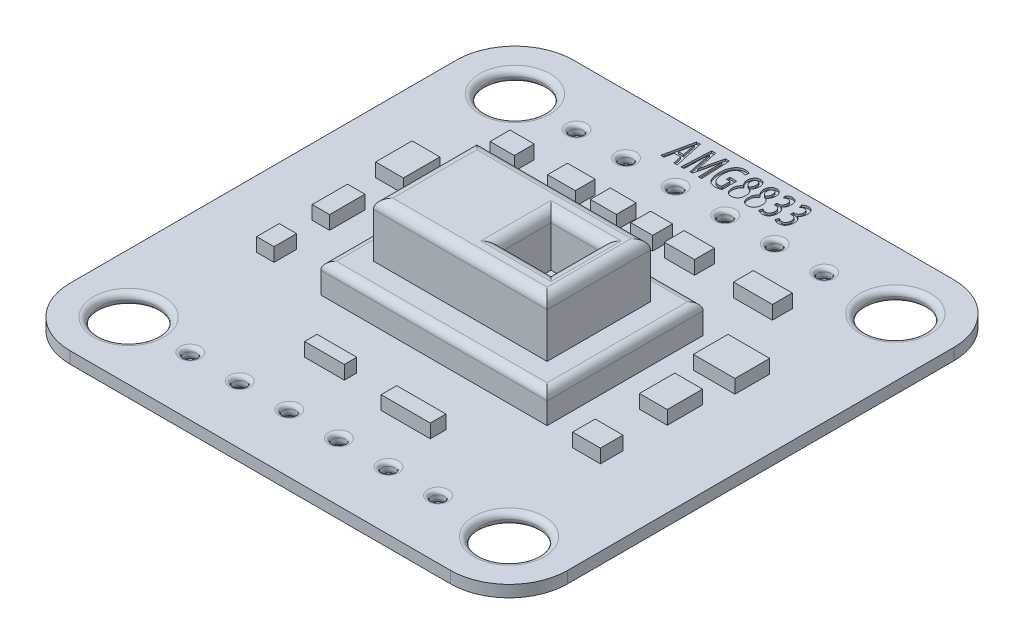
from build123d import *

# Parameters (mm, degrees)
CROQUIS1_W              = 25.5
CROQUIS1_H              = 25.8
SALIENTE_EXTRUIR1_DEPTH = 0.6
REDONDEO1_R             = 3
CROQUIS2_R              = 1.5
CORTAR_EXTRUIR1_DEPTH   = 19.147520492
REDONDEO3_R             = 0.3
CROQUIS3_W              = 11.6
CROQUIS3_H              = 8
SALIENTE_EXTRUIR2_DEPTH = 1.5
CROQUIS4_W              = 8.9
CROQUIS4_H              = 5.3
SALIENTE_EXTRUIR3_DEPTH = 2.8
REDONDEO4_R             = 0.4
REDONDEO5_R             = 0.5
CROQUIS5_W              = 2.6
CROQUIS5_H              = 2.6
CORTAR_EXTRUIR2_DEPTH   = 2.6
REDONDEO6_R             = 0.5
CROQUIS6_W              = 1.241092342
CROQUIS6_H              = 1.019085601
CROQUIS6_W_2            = 1.417923928
CROQUIS6_W_3            = 1.329303683
CROQUIS6_W_4            = 1.12466552
CROQUIS6_W_5            = 1.550854297
CROQUIS6_W_6            = 1.993955524
CROQUIS6_W_7            = 2.13557037
CROQUIS6_H_2            = 1.779641975
CROQUIS6_W_8            = 1.42371358
CROQUIS6_H_3            = 1.809919236
CROQUIS6_H_4            = 1.156767284
CROQUIS6_W_9            = 2.037698147
CROQUIS6_H_5            = 0.635905205
CROQUIS6_W_10           = 2.519879521
CROQUIS6_H_6            = 0.799384874
CROQUIS6_H_7            = 1.868624073
CROQUIS6_W_11           = 0.889820988
CROQUIS6_H_8            = 1.156767283
SALIENTE_EXTRUIR4_DEPTH = 0.7
CROQUIS7_R              = 0.325
CORTAR_EXTRUIR3_DEPTH   = 19.640346027
REDONDEO7_R             = 0.2
REDONDEO8_R             = 0.2
CORTAR_EXTRUIR4_DEPTH   = 0.1


with BuildPart() as part:
    # Croquis1 → Saliente-Extruir1 (new body)
    with BuildSketch(Plane(origin=(0, 0, 0), x_dir=(1, 0, 0), z_dir=(0, 1, 0))):
        Rectangle(CROQUIS1_W, CROQUIS1_H)
    extrude(amount=SALIENTE_EXTRUIR1_DEPTH)

    # Redondeo1
    redondeo1_edges = [part.edges().sort_by_distance(p)[0] for p in [
        (12.75, 0.3, 12.9),
        (-12.75, 0.3, 12.9),
        (-12.75, 0.3, -12.9),
        (12.75, 0.3, -12.9),
    ]]
    fillet(redondeo1_edges, radius=REDONDEO1_R)

    # Croquis2 → Cortar-Extruir1 (cut, through all)
    with BuildSketch(Plane.XZ):
        with Locations(Location((9.75, -9.9, 0), (0, 0, 270))):
            Circle(CROQUIS2_R)
        with Locations(Location((-9.75, -9.9, 0), (0, 0, 270))):
            Circle(CROQUIS2_R)
        with Locations(Location((-9.75, 9.9, 0), (0, 0, 270))):
            Circle(CROQUIS2_R)
        with Locations(Location((9.75, 9.9, 0), (0, 0, 270))):
            Circle(CROQUIS2_R)
    extrude(amount=-CORTAR_EXTRUIR1_DEPTH, mode=Mode.SUBTRACT)

    # Redondeo3
    redondeo3_edges = [part.edges().sort_by_distance(p)[0] for p in [
        (9.75, 0.6, 11.4),
        (9.75, 0, 11.4),
        (-9.75, 0.6, 11.4),
        (-9.75, 0, 11.4),
        (-9.75, 0.6, -8.4),
        (-9.75, 0, -8.4),
        (9.75, 0.6, -8.4),
        (9.75, 0, -8.4),
    ]]
    fillet(redondeo3_edges, radius=REDONDEO3_R - 0.0001)  # a hair under: the kernel refuses the full size

    # Croquis3 → Saliente-Extruir2 (add)
    with BuildSketch(Plane(origin=(0, 0.6, 0), x_dir=(1, 0, 0), z_dir=(0, 1, 0))):
        Rectangle(CROQUIS3_W, CROQUIS3_H)
    extrude(amount=SALIENTE_EXTRUIR2_DEPTH)

    # Croquis4 → Saliente-Extruir3 (add)
    with BuildSketch(Plane(origin=(0, 2.1, 0), x_dir=(1, 0, 0), z_dir=(0, 1, 0))):
        Rectangle(CROQUIS4_W, CROQUIS4_H)
    extrude(amount=SALIENTE_EXTRUIR3_DEPTH)

    # Redondeo4
    redondeo4_edges = [part.edges().sort_by_distance(p)[0] for p in [
        (5.8, 2.1, 0),
        (0, 2.1, -4),
        (-5.8, 2.1, 0),
        (0, 2.1, 4),
    ]]
    fillet(redondeo4_edges, radius=REDONDEO4_R)

    # Redondeo5
    redondeo5_edges = [part.edges().sort_by_distance(p)[0] for p in [
        (4.45, 4.9, 0),
        (0, 4.9, -2.65),
        (-4.45, 4.9, 0),
        (0, 4.9, 2.65),
    ]]
    fillet(redondeo5_edges, radius=REDONDEO5_R)

    # Croquis5 → Cortar-Extruir2 (cut)
    with BuildSketch(Plane(origin=(0, 4.9, 0), x_dir=(1, 0, 0), z_dir=(0, 1, 0))):
        with Locations((2, 0)):
            Rectangle(CROQUIS5_W, CROQUIS5_H)
    extrude(amount=-CORTAR_EXTRUIR2_DEPTH, mode=Mode.SUBTRACT)

    # Redondeo6
    redondeo6_edges = [part.edges().sort_by_distance(p)[0] for p in [
        (3.3, 4.9, 0),
        (2, 4.9, -1.3),
        (0.7, 4.9, 0),
        (2, 4.9, 1.3),
    ]]
    fillet(redondeo6_edges, radius=REDONDEO6_R)

    # Croquis6 → Saliente-Extruir4 (add)
    with BuildSketch(Plane(origin=(0, 0.6, 0), x_dir=(1, 0, 0), z_dir=(0, 1, 0))):
        with Locations((-6.953062528, 6.960785668)):
            Rectangle(CROQUIS6_W, CROQUIS6_H)
        with Locations((-3.917614666, 6.960785668)):
            Rectangle(CROQUIS6_W_2, CROQUIS6_H)
        with Locations((-1.768573713, 6.960785668)):
            Rectangle(CROQUIS6_W_3, CROQUIS6_H)
        with Locations((0.194770525, 6.960785668)):
            Rectangle(CROQUIS6_W_4, CROQUIS6_H)
        with Locations((2.130717091, 6.960785668)):
            Rectangle(CROQUIS6_W_5, CROQUIS6_H)
        with Locations((5.897077525, 6.960785668)):
            Rectangle(CROQUIS6_W_6, CROQUIS6_H)
        with Locations((8.151199134, 3.099234825)):
            Rectangle(CROQUIS6_W_7, CROQUIS6_H_2)
        with Locations((8.151199134, 0)):
            Rectangle(CROQUIS6_W_8, CROQUIS6_H_3)
        with Locations((8.151199134, -3.752386777)):
            Rectangle(CROQUIS6_W_8, CROQUIS6_H_4)
        with Locations((-2.433225553, -6.860971984)):
            Rectangle(CROQUIS6_W_9, CROQUIS6_H_5)
        with Locations((2.130717091, -7.178924586)):
            Rectangle(CROQUIS6_W_10, CROQUIS6_H_6)
        with Locations((-8.888872774, 3.54414532)):
            Rectangle(CROQUIS6_W_8, CROQUIS6_H_7)
        with Locations((-8.888872774, 0)):
            Rectangle(CROQUIS6_W_11, CROQUIS6_H_3)
        with Locations((-8.888872774, -3.174003136)):
            Rectangle(CROQUIS6_W_11, CROQUIS6_H_8)
    extrude(amount=SALIENTE_EXTRUIR4_DEPTH)

    # Croquis7 → Cortar-Extruir3 (cut, through all)
    with BuildSketch(Plane(origin=(0, 0.6, 0), x_dir=(1, 0, 0), z_dir=(0, 1, 0))):
        with Locations(Location((-6.594083047, 9.9, 0), (0, 0, 270))):
            Circle(CROQUIS7_R)
        with Locations(Location((-4.054083047, 9.9, 0), (0, 0, 270))):
            Circle(CROQUIS7_R)
        with Locations(Location((-1.514083047, 9.9, 0), (0, 0, 270))):
            Circle(CROQUIS7_R)
        with Locations(Location((1.025916953, 9.9, 0), (0, 0, 270))):
            Circle(CROQUIS7_R)
        with Locations(Location((3.565916953, 9.9, 0), (0, 0, 270))):
            Circle(CROQUIS7_R)
        with Locations(Location((6.105916953, 9.9, 0), (0, 0, 270))):
            Circle(CROQUIS7_R)
        with Locations(Location((6.105916953, -9.9, 0), (0, 0, 90))):
            Circle(CROQUIS7_R)
        with Locations(Location((3.565916953, -9.9, 0), (0, 0, 90))):
            Circle(CROQUIS7_R)
        with Locations(Location((1.025916953, -9.9, 0), (0, 0, 90))):
            Circle(CROQUIS7_R)
        with Locations(Location((-1.514083047, -9.9, 0), (0, 0, 90))):
            Circle(CROQUIS7_R)
        with Locations(Location((-4.054083047, -9.9, 0), (0, 0, 90))):
            Circle(CROQUIS7_R)
        with Locations(Location((-6.594083047, -9.9, 0), (0, 0, 90))):
            Circle(CROQUIS7_R)
    extrude(amount=-CORTAR_EXTRUIR3_DEPTH, mode=Mode.SUBTRACT)

    # Redondeo7
    redondeo7_edges = [part.edges().sort_by_distance(p)[0] for p in [
        (1.025916953, 0, -10.225),
        (3.565916953, 0, -10.225),
        (3.565916953, 0.6, -10.225),
        (-6.594083047, 0, -10.225),
        (-6.594083047, 0.6, -10.225),
        (-4.054083047, 0, -10.225),
        (-4.054083047, 0.6, -10.225),
        (-1.514083047, 0, -10.225),
        (-1.514083047, 0.6, -10.225),
    ]]
    fillet(redondeo7_edges, radius=REDONDEO7_R)

    # Redondeo8
    redondeo8_edges = [part.edges().sort_by_distance(p)[0] for p in [
        (1.025916953, 0.6, -10.225),
        (6.105916953, 0, -10.225),
        (6.105916953, 0.6, -10.225),
        (1.025916953, 0, 10.225),
        (1.025916953, 0.6, 10.225),
        (3.565916953, 0, 10.225),
        (3.565916953, 0.6, 10.225),
        (-1.514083047, 0, 10.225),
        (-1.514083047, 0.6, 10.225),
        (-4.054083047, 0, 10.225),
        (-4.054083047, 0.6, 10.225),
        (-6.594083047, 0, 10.225),
        (-6.594083047, 0.6, 10.225),
        (6.105916953, 0, 10.225),
        (6.105916953, 0.6, 10.225),
    ]]
    fillet(redondeo8_edges, radius=REDONDEO8_R)

    # Croquis8 → Cortar-Extruir4 (cut)
    # profile 1 of 7: a face of its own
    with BuildSketch(Plane(origin=(0, 0.6, 0), x_dir=(1, 0, 0), z_dir=(0, 1, 0))):
        Polygon((-2.764400595, 12.416489661), (-2.962346086, 12.416489661), (-3.2885493, 10.908742762), (-3.122654054, 10.908742762), (-3.03065122, 11.349566146), (-2.704459355, 11.349566146), (-2.608274575, 10.908742762), (-2.43820873, 10.908742762), align=None)
        with BuildLine():
            Line((-3.005559538, 11.527854714), (-2.920526616, 11.924550087))
            add(Edge.make_bspline(
                [(-2.920526616, 11.924550087), (-2.916048313, 11.948626049), (-2.906891621, 11.997853653), (-2.894461995, 12.072451535), (-2.882642299, 12.147072958), (-2.874462424, 12.196368554), (-2.870465323, 12.220456883)],
                knots=[0, 0, 0, 0, 0.979142055, 2.002030703, 3.023690823, 4, 4, 4, 4], degree=3))
            Line((-2.870465323, 12.220456883), (-2.867555288, 12.220568158))
            add(Edge.make_bspline(
                [(-2.867555288, 12.220568158), (-2.863662854, 12.196618467), (-2.855693728, 12.14758537), (-2.84263149, 12.073324881), (-2.829367717, 11.997845382), (-2.819525579, 11.94757712), (-2.81462631, 11.922554333)],
                knots=[0, 0, 0, 0, 0.961914449, 1.969363357, 2.989179584, 4, 4, 4, 4], degree=3))
            Line((-2.81462631, 11.922554333), (-2.730945019, 11.527854714))
            Line((-2.730945019, 11.527854714), (-3.005559538, 11.527854714))
        make_face(mode=Mode.SUBTRACT)
    # profile 2 of 7: a face of its own
    with BuildSketch(Plane(origin=(0, 0.6, 0), x_dir=(1, 0, 0), z_dir=(0, 1, 0))):
        with BuildLine():
            Line((-1.268873463, 12.415728175), (-1.471321993, 12.415728175))
            Line((-1.471321993, 12.415728175), (-1.626299833, 11.756505461))
            add(Edge.make_bspline(
                [(-1.626299833, 11.756505461), (-1.636389672, 11.710881327), (-1.656162529, 11.621472626), (-1.683054942, 11.489435003), (-1.707300051, 11.362274166), (-1.721503439, 11.278870207), (-1.728458309, 11.238030398)],
                knots=[0, 0, 0, 0, 1.060921548, 2.079066685, 3.059390553, 4, 4, 4, 4], degree=3))
            Line((-1.728458309, 11.238030398), (-1.732410786, 11.238030398))
            add(Edge.make_bspline(
                [(-1.732410786, 11.238030398), (-1.739306373, 11.27924215), (-1.753318672, 11.362987222), (-1.776586546, 11.490282051), (-1.802487074, 11.621185731), (-1.820882201, 11.709606578), (-1.830215698, 11.754470402)],
                knots=[0, 0, 0, 0, 0.953857503, 1.938303067, 2.953916282, 4, 4, 4, 4], degree=3))
            Line((-1.830215698, 11.754470402), (-1.980933809, 12.415728175))
            Line((-1.980933809, 12.415728175), (-2.181986142, 12.415728175))
            Line((-2.181986142, 12.415728175), (-2.254535504, 10.918193387))
            Line((-2.254535504, 10.918193387), (-2.103799124, 10.918193387))
            Line((-2.103799124, 10.918193387), (-2.080063779, 11.532618502))
            add(Edge.make_bspline(
                [(-2.080063779, 11.532618502), (-2.07799724, 11.586443032), (-2.073827016, 11.695059557), (-2.069204966, 11.830807), (-2.065665491, 11.93898623), (-2.063794803, 12.017507278), (-2.062037377, 12.093186493), (-2.061112421, 12.142603124), (-2.060657917, 12.166885444)],
                knots=[0, 0, 0, 0, 1.527873866, 3.083210374, 3.852754726, 4.598036934, 5.311104062, 6, 6, 6, 6], degree=3))
            Line((-2.060657917, 12.166885444), (-2.056328434, 12.166907865))
            add(Edge.make_bspline(
                [(-2.056328434, 12.166907865), (-2.049160872, 12.120575255), (-2.034643174, 12.026729843), (-2.00931025, 11.884785972), (-1.980640242, 11.739967165), (-1.959611896, 11.642667624), (-1.948979892, 11.59347264)],
                knots=[0, 0, 0, 0, 0.964146216, 1.952851327, 2.964954549, 4, 4, 4, 4], degree=3))
            Line((-1.948979892, 11.59347264), (-1.802220624, 10.931907892))
            Line((-1.802220624, 10.931907892), (-1.680751506, 10.931907892))
            Line((-1.680751506, 10.931907892), (-1.521585076, 11.607247489))
            add(Edge.make_bspline(
                [(-1.521585076, 11.607247489), (-1.510503263, 11.6550693), (-1.488527041, 11.749904212), (-1.45778466, 11.891123119), (-1.428891866, 12.029763094), (-1.411609861, 12.121505586), (-1.403061424, 12.166885444)],
                knots=[0, 0, 0, 0, 1.02964351, 2.041874823, 3.031425434, 4, 4, 4, 4], degree=3))
            Line((-1.403061424, 12.166885444), (-1.398719761, 12.166907865))
            add(Edge.make_bspline(
                [(-1.398719761, 12.166907865), (-1.398797642, 12.142807295), (-1.398956434, 12.093668106), (-1.398287712, 12.018734702), (-1.397271715, 11.94125297), (-1.394427882, 11.835245237), (-1.390486184, 11.702587858), (-1.386762759, 11.596589072), (-1.384920831, 11.544152903)],
                knots=[0, 0, 0, 0, 0.696372589, 1.419849533, 2.16522606, 2.935329954, 4.483949109, 6, 6, 6, 6], degree=3))
            Line((-1.384920831, 11.544152903), (-1.361022449, 10.918193387))
            Line((-1.361022449, 10.918193387), (-1.204648412, 10.918193387))
            Line((-1.204648412, 10.918193387), (-1.268873463, 12.415728175))
        make_face()
    # profile 3 of 7: a face of its own
    with BuildSketch(Plane(origin=(0, 0.6, 0), x_dir=(1, 0, 0), z_dir=(0, 1, 0))):
        with BuildLine():
            Line((-0.190327799, 11.709260643), (-0.537451544, 11.709260643))
            Line((-0.537451544, 11.709260643), (-0.537451544, 11.530972075))
            Line((-0.537451544, 11.530972075), (-0.348220934, 11.530972075))
            Line((-0.348220934, 11.530972075), (-0.348220934, 11.105833761))
            add(Edge.make_bspline(
                [(-0.348220934, 11.105833761), (-0.351696156, 11.103397337), (-0.359020517, 11.098262342), (-0.372076466, 11.092444867), (-0.387133711, 11.087516611), (-0.404284847, 11.082748713), (-0.423802141, 11.079735444), (-0.445404844, 11.076652449), (-0.469280143, 11.075208984), (-0.485922023, 11.07454499), (-0.494614544, 11.074198168)],
                knots=[0, 0, 0, 0, 0.669732272, 1.411524396, 2.247639135, 3.175225154, 4.221402202, 5.366457803, 6.624427111, 8, 8, 8, 8], degree=3))
            add(Edge.make_bspline(
                [(-0.494614544, 11.074198168), (-0.507969933, 11.074707965), (-0.534210459, 11.075709608), (-0.572493351, 11.083032692), (-0.608756696, 11.094573752), (-0.642876832, 11.111067459), (-0.675089043, 11.131767875), (-0.705024223, 11.157464023), (-0.733184255, 11.187289479), (-0.759020179, 11.221810296), (-0.782213175, 11.260786636), (-0.80264251, 11.304051246), (-0.819883182, 11.351614773), (-0.833888502, 11.403424823), (-0.845267578, 11.459457912), (-0.853289276, 11.519782778), (-0.858394839, 11.584318433), (-0.859439211, 11.628704885), (-0.859977423, 11.651579227)],
                knots=[0, 0, 0, 0, 0.840022945, 1.650468165, 2.443920939, 3.22841292, 4.028255306, 4.846621894, 5.704631313, 6.604782332, 7.55407384, 8.554051379, 9.611115594, 10.733290272, 11.92845612, 13.206533379, 14.560400581, 16, 16, 16, 16], degree=3))
            add(Edge.make_bspline(
                [(-0.859977423, 11.651579227), (-0.859487722, 11.675117584), (-0.858536381, 11.720845523), (-0.852775809, 11.787082455), (-0.844067753, 11.848892312), (-0.832372262, 11.906266278), (-0.817090576, 11.959158283), (-0.79862558, 12.007614529), (-0.777338042, 12.051822827), (-0.75216505, 12.091038392), (-0.724657838, 12.125840972), (-0.694788121, 12.156060714), (-0.662871917, 12.181794412), (-0.628981125, 12.203026347), (-0.592893721, 12.219279798), (-0.554814692, 12.230936872), (-0.51464383, 12.238278327), (-0.487087802, 12.239053538), (-0.47307259, 12.239447816)],
                knots=[0, 0, 0, 0, 1.434220963, 2.786259491, 4.048201453, 5.235976806, 6.350984325, 7.398765591, 8.392586444, 9.334829251, 10.232120147, 11.091064484, 11.918224649, 12.724958455, 13.52110572, 14.322336264, 15.146727113, 16, 16, 16, 16], degree=3))
            add(Edge.make_bspline(
                [(-0.47307259, 12.239447816), (-0.461061194, 12.239270524), (-0.438025679, 12.238930511), (-0.404926965, 12.235239557), (-0.374497616, 12.230524568), (-0.346825713, 12.222922061), (-0.321558097, 12.214030364), (-0.298043254, 12.204478452), (-0.276567182, 12.193475961), (-0.26326696, 12.185119324), (-0.256802709, 12.181057783)],
                knots=[0, 0, 0, 0, 1.267740505, 2.431279107, 3.513846429, 4.515803912, 5.456104541, 6.341779672, 7.194062062, 8, 8, 8, 8], degree=3))
            Line((-0.256802709, 12.181057783), (-0.219932762, 12.370299465))
            add(Edge.make_bspline(
                [(-0.219932762, 12.370299465), (-0.227229977, 12.37491302), (-0.242354063, 12.384474999), (-0.267554558, 12.396593542), (-0.295734716, 12.407299554), (-0.326772528, 12.416635153), (-0.360435171, 12.423872948), (-0.396222208, 12.429190144), (-0.433981091, 12.43273101), (-0.459836803, 12.43312415), (-0.47307259, 12.433325403)],
                knots=[0, 0, 0, 0, 0.783008094, 1.622849696, 2.532134412, 3.516884653, 4.561348015, 5.653977854, 6.799048724, 8, 8, 8, 8], degree=3))
            add(Edge.make_bspline(
                [(-0.47307259, 12.433325403), (-0.493431738, 12.432478512), (-0.533272385, 12.43082124), (-0.591294781, 12.420308156), (-0.646191551, 12.40394505), (-0.697884492, 12.380859107), (-0.746123114, 12.351005052), (-0.791180438, 12.314989129), (-0.833083837, 12.272645303), (-0.87158756, 12.224096305), (-0.906076995, 12.169615149), (-0.936131749, 12.109632096), (-0.961999305, 12.04462258), (-0.98272835, 11.974144103), (-0.999594022, 11.898612244), (-1.011063069, 11.817661771), (-1.01898188, 11.731568656), (-1.020298151, 11.672384087), (-1.020975186, 11.641942037)],
                knots=[0, 0, 0, 0, 0.906699512, 1.774312703, 2.618366945, 3.452862323, 4.287941105, 5.138391531, 6.016232104, 6.935693918, 7.893004635, 8.882947244, 9.919948231, 11.005043757, 12.151655388, 13.363972965, 14.644138676, 16, 16, 16, 16], degree=3))
            add(Edge.make_bspline(
                [(-1.020975186, 11.641942037), (-1.021586059, 11.62484134), (-1.022831851, 11.589966858), (-1.020293999, 11.536659539), (-1.014585212, 11.481498991), (-1.005480197, 11.424536902), (-0.992827762, 11.365857729), (-0.977321929, 11.305250391), (-0.957807008, 11.243025455), (-0.939502551, 11.190342964), (-0.922591182, 11.148482338), (-0.907514428, 11.118777483), (-0.890727368, 11.090781083), (-0.872057525, 11.064624288), (-0.851201882, 11.040514874), (-0.828723416, 11.017992895), (-0.804442567, 10.997162458), (-0.777733976, 10.978908045), (-0.74973994, 10.961666373), (-0.719613347, 10.946743401), (-0.687662932, 10.933669617), (-0.653848677, 10.922361486), (-0.618183647, 10.912721608), (-0.580600132, 10.905080631), (-0.541121121, 10.899433166), (-0.514091794, 10.897101379), (-0.500283479, 10.895910153)],
                knots=[0, 0, 0, 0, 1.200937957, 2.449145116, 3.742844556, 5.092948573, 6.496738947, 7.955995764, 9.483464093, 11.073764752, 11.870794349, 12.651001375, 13.409793533, 14.160862787, 14.904099292, 15.64520142, 16.393482676, 17.146132082, 17.914031917, 18.700166393, 19.503328029, 20.336103367, 21.201806113, 22.095544012, 23.027081715, 24, 24, 24, 24], degree=3))
            add(Edge.make_bspline(
                [(-0.500283479, 10.895910153), (-0.484114448, 10.896471192), (-0.452372217, 10.897572596), (-0.405905824, 10.902504799), (-0.36152697, 10.909645785), (-0.319916743, 10.920018228), (-0.281597736, 10.931528845), (-0.247093586, 10.943332425), (-0.217071878, 10.955635989), (-0.19893097, 10.964778454), (-0.190476166, 10.969039418)],
                knots=[0, 0, 0, 0, 1.209195894, 2.37383259, 3.490953063, 4.566847826, 5.576966633, 6.481686065, 7.292370178, 8, 8, 8, 8], degree=3))
            Line((-0.190476166, 10.969039418), (-0.190327799, 11.709260643))
        make_face()
    # profile 4 of 7: a face of its own
    with BuildSketch(Plane(origin=(0, 0.6, 0), x_dir=(1, 0, 0), z_dir=(0, 1, 0))):
        with BuildLine():
            add(Edge.make_bspline(
                [(0.193356149, 11.68007227), (0.1785492, 11.670055793), (0.149049568, 11.650100136), (0.110576786, 11.612336066), (0.076664892, 11.569597675), (0.047598932, 11.521405578), (0.024134701, 11.467749991), (0.007760194, 11.408574082), (-0.003109068, 11.344339011), (-0.004422547, 11.299680216), (-0.005101982, 11.276579158)],
                knots=[0, 0, 0, 0, 0.911404418, 1.815775479, 2.739708829, 3.692232617, 4.681957349, 5.720608342, 6.820918456, 8, 8, 8, 8], degree=3))
            add(Edge.make_bspline(
                [(-0.005101982, 11.276579158), (-0.004810586, 11.263343088), (-0.004238943, 11.237377368), (-0.000325718, 11.199345118), (0.006611902, 11.163088591), (0.015811798, 11.12840306), (0.028107491, 11.095444407), (0.042869752, 11.064135249), (0.060217079, 11.034463073), (0.080242124, 11.006752324), (0.1028913, 10.981408686), (0.128219317, 10.959105912), (0.156316294, 10.940328162), (0.186791859, 10.924587387), (0.219896499, 10.912513613), (0.255395684, 10.90342009), (0.29336004, 10.897365167), (0.319610665, 10.896215363), (0.333050008, 10.895626706)],
                knots=[0, 0, 0, 0, 1.107648422, 2.172917551, 3.19484565, 4.1941329, 5.172301612, 6.134327233, 7.087637994, 8.044483428, 8.990685234, 9.926389602, 10.860589487, 11.811832291, 12.790001003, 13.80255694, 14.874991015, 16, 16, 16, 16], degree=3))
            add(Edge.make_bspline(
                [(0.333050008, 10.895626706), (0.345824235, 10.896033183), (0.370826603, 10.896828759), (0.40730887, 10.90231231), (0.441747722, 10.911145888), (0.474463397, 10.923019967), (0.505039507, 10.938654643), (0.533611011, 10.957640717), (0.560561338, 10.979503054), (0.585095522, 11.005161453), (0.607487902, 11.033631591), (0.626900177, 11.065144835), (0.643253314, 11.099427363), (0.657332141, 11.136200396), (0.667556397, 11.176014472), (0.675524141, 11.218321886), (0.680739014, 11.263509826), (0.681554119, 11.294610925), (0.681972975, 11.310592769)],
                knots=[0, 0, 0, 0, 1.004575452, 1.966206168, 2.894436783, 3.797272911, 4.697934967, 5.588329482, 6.491318517, 7.421540057, 8.374430723, 9.335458257, 10.325916415, 11.358334626, 12.427256579, 13.553903944, 14.743030673, 16, 16, 16, 16], degree=3))
            add(Edge.make_bspline(
                [(0.681972975, 11.310592769), (0.681154516, 11.332651205), (0.67956765, 11.375419155), (0.668983739, 11.436924959), (0.652046329, 11.493495129), (0.628334839, 11.544732874), (0.599309642, 11.590753134), (0.566042133, 11.631636954), (0.52832027, 11.667146612), (0.499997831, 11.686242864), (0.485827814, 11.695796922)],
                knots=[0, 0, 0, 0, 1.171501565, 2.271363273, 3.304917842, 4.299727248, 5.260519595, 6.187826369, 7.093350242, 8, 8, 8, 8], degree=3))
            Line((0.485827814, 11.695796922), (0.486064757, 11.701922029))
            add(Edge.make_bspline(
                [(0.486064757, 11.701922029), (0.498931474, 11.712902216), (0.524440343, 11.734670951), (0.557397786, 11.772330855), (0.584886977, 11.813522613), (0.606627858, 11.857879053), (0.622957399, 11.904168431), (0.635493424, 11.951209349), (0.642716757, 11.999047586), (0.643566043, 12.031185814), (0.643991108, 12.04727091)],
                knots=[0, 0, 0, 0, 1.031979959, 2.045948748, 3.044565518, 4.048386527, 5.054063212, 6.037934608, 7.017991582, 8, 8, 8, 8], degree=3))
            add(Edge.make_bspline(
                [(0.643991108, 12.04727091), (0.643777313, 12.05880571), (0.643355779, 12.08154864), (0.639906299, 12.114998475), (0.634163731, 12.147281064), (0.626445953, 12.178476139), (0.615611429, 12.208339957), (0.603435151, 12.237384622), (0.588132359, 12.264911104), (0.571128495, 12.291223676), (0.551582885, 12.31538097), (0.529672771, 12.336898503), (0.505056354, 12.355177792), (0.477952669, 12.370217919), (0.448535119, 12.382165717), (0.41677108, 12.390952375), (0.382553555, 12.396609405), (0.358864682, 12.3980186), (0.346655452, 12.398744898)],
                knots=[0, 0, 0, 0, 1.070993307, 2.11165556, 3.118517725, 4.114425173, 5.091211043, 6.065866687, 7.035692375, 8.011532052, 8.972105901, 9.915210373, 10.855781041, 11.810244717, 12.786202718, 13.797375475, 14.864768794, 16, 16, 16, 16], degree=3))
            add(Edge.make_bspline(
                [(0.346655452, 12.398744898), (0.335672497, 12.398441494), (0.314056918, 12.397844364), (0.282470489, 12.392430629), (0.252350057, 12.384601171), (0.223557602, 12.37375607), (0.196436349, 12.359532592), (0.170641868, 12.342280583), (0.146208996, 12.322176076), (0.123560638, 12.298840697), (0.10286139, 12.272793333), (0.084605708, 12.244055392), (0.069401026, 12.212677798), (0.056526101, 12.178936025), (0.04637937, 12.142694443), (0.039125944, 12.103799767), (0.034181526, 12.062510141), (0.0333206, 12.034058021), (0.032879884, 12.019493127)],
                knots=[0, 0, 0, 0, 0.954965825, 1.879470434, 2.780837939, 3.660343497, 4.550239683, 5.439528016, 6.356397421, 7.29824966, 8.263809139, 9.24685125, 10.254308888, 11.29259344, 12.385771216, 13.524141038, 14.732585787, 16, 16, 16, 16], degree=3))
            add(Edge.make_bspline(
                [(0.032879884, 12.019493127), (0.033229667, 12.003301327), (0.033925109, 11.971108645), (0.042150107, 11.923687915), (0.054055995, 11.877357218), (0.071776605, 11.832868782), (0.094250697, 11.790655752), (0.122093825, 11.751643886), (0.155028479, 11.716195033), (0.180465114, 11.696049759), (0.193310753, 11.685876285)],
                knots=[0, 0, 0, 0, 1.009979823, 2.00805091, 2.996924765, 3.992813739, 4.990588339, 5.976147839, 6.977943669, 8, 8, 8, 8], degree=3))
            Line((0.193310753, 11.685876285), (0.193356149, 11.68007227))
        make_face()
        with BuildLine():
            add(Edge.make_bspline(
                [(0.341189137, 12.256170621), (0.347367452, 12.255508325), (0.359404391, 12.254218003), (0.37689185, 12.250765884), (0.392923806, 12.244590703), (0.407772208, 12.236817077), (0.42097725, 12.226469903), (0.433280809, 12.214748588), (0.443764513, 12.20049589), (0.456291679, 12.179095444), (0.468598223, 12.149179396), (0.479082075, 12.11050638), (0.485397129, 12.068925887), (0.48605603, 12.04020708), (0.486394707, 12.025445509)],
                knots=[0, 0, 0, 0, 0.737040501, 1.435943419, 2.106138943, 2.76794432, 3.415653856, 4.089213461, 4.777251942, 5.505627577, 7.027057119, 8.595626037, 10.250139479, 12, 12, 12, 12], degree=3))
            add(Edge.make_bspline(
                [(0.486394707, 12.025445509), (0.485789169, 12.010864369), (0.484605604, 11.982364583), (0.47717219, 11.941115209), (0.465143278, 11.902698793), (0.449112635, 11.86737616), (0.42957729, 11.835888974), (0.408031707, 11.808075861), (0.383504011, 11.785138047), (0.365257937, 11.773127128), (0.356292642, 11.767225507)],
                knots=[0, 0, 0, 0, 1.15994323, 2.267184327, 3.322678351, 4.35528353, 5.344037239, 6.264342936, 7.147176663, 8, 8, 8, 8], degree=3))
            add(Edge.make_bspline(
                [(0.356292642, 11.767225507), (0.344324841, 11.773471734), (0.320703327, 11.78580026), (0.288318303, 11.808876113), (0.260229376, 11.83617519), (0.235310311, 11.86656757), (0.215505937, 11.901674436), (0.201373337, 11.941443444), (0.192514356, 11.985854506), (0.191175025, 12.017087509), (0.190476285, 12.033382018)],
                knots=[0, 0, 0, 0, 0.973172951, 1.92080545, 2.856002324, 3.791671, 4.746993565, 5.747424678, 6.824813306, 8, 8, 8, 8], degree=3))
            add(Edge.make_bspline(
                [(0.190476285, 12.033382018), (0.190897024, 12.047673299), (0.19171573, 12.075482394), (0.198483991, 12.115768016), (0.210376145, 12.15302162), (0.223493689, 12.181936559), (0.2368807, 12.202559719), (0.247773555, 12.216391571), (0.260547792, 12.227732737), (0.274142806, 12.23750728), (0.289113958, 12.245283802), (0.30535592, 12.250882347), (0.322779171, 12.254665541), (0.334825967, 12.255474195), (0.341189137, 12.256170621)],
                knots=[0, 0, 0, 0, 1.719237767, 3.345427867, 4.895260788, 6.416002682, 7.147651972, 7.850831243, 8.526924288, 9.195712161, 9.861885491, 10.548696538, 11.257825366, 12, 12, 12, 12], degree=3))
        make_face(mode=Mode.SUBTRACT)
    # profile 5 of 7: a face of its own
    with BuildSketch(Plane(origin=(0, 0.6, 0), x_dir=(1, 0, 0), z_dir=(0, 1, 0))):
        with BuildLine():
            add(Edge.make_bspline(
                [(1.027823423, 11.68007227), (1.013016474, 11.670055793), (0.983516842, 11.650100136), (0.945044061, 11.612336066), (0.911132166, 11.569597675), (0.882066206, 11.521405578), (0.858601975, 11.467749991), (0.842227468, 11.408574082), (0.831358206, 11.344339011), (0.830044727, 11.299680216), (0.829365292, 11.276579158)],
                knots=[0, 0, 0, 0, 0.911404418, 1.815775479, 2.739708829, 3.692232617, 4.681957349, 5.720608342, 6.820918456, 8, 8, 8, 8], degree=3))
            add(Edge.make_bspline(
                [(0.829365292, 11.276579158), (0.829656688, 11.263343088), (0.830228332, 11.237377368), (0.834141556, 11.199345118), (0.841079176, 11.163088591), (0.850279072, 11.12840306), (0.862574765, 11.095444407), (0.877337026, 11.064135249), (0.894684353, 11.034463073), (0.914709398, 11.006752324), (0.937358574, 10.981408686), (0.962686591, 10.959105912), (0.990783569, 10.940328162), (1.021259133, 10.924587387), (1.054363773, 10.912513613), (1.089862958, 10.90342009), (1.127827315, 10.897365167), (1.15407794, 10.896215363), (1.167517282, 10.895626706)],
                knots=[0, 0, 0, 0, 1.107648422, 2.172917551, 3.19484565, 4.1941329, 5.172301612, 6.134327233, 7.087637994, 8.044483428, 8.990685234, 9.926389602, 10.860589487, 11.811832291, 12.790001003, 13.80255694, 14.874991015, 16, 16, 16, 16], degree=3))
            add(Edge.make_bspline(
                [(1.167517282, 10.895626706), (1.180291509, 10.896033183), (1.205293877, 10.896828759), (1.241776145, 10.90231231), (1.276214996, 10.911145888), (1.308930671, 10.923019967), (1.339506781, 10.938654643), (1.368078285, 10.957640717), (1.395028612, 10.979503054), (1.419562796, 11.005161453), (1.441955177, 11.033631591), (1.461367451, 11.065144835), (1.477720589, 11.099427363), (1.491799416, 11.136200396), (1.502023672, 11.176014472), (1.509991415, 11.218321886), (1.515206288, 11.263509826), (1.516021393, 11.294610925), (1.516440249, 11.310592769)],
                knots=[0, 0, 0, 0, 1.004575452, 1.966206168, 2.894436783, 3.797272911, 4.697934967, 5.588329482, 6.491318517, 7.421540057, 8.374430723, 9.335458257, 10.325916415, 11.358334626, 12.427256579, 13.553903944, 14.743030673, 16, 16, 16, 16], degree=3))
            add(Edge.make_bspline(
                [(1.516440249, 11.310592769), (1.51562179, 11.332651205), (1.514034925, 11.375419155), (1.503451014, 11.436924959), (1.486513604, 11.493495129), (1.462802113, 11.544732874), (1.433776916, 11.590753134), (1.400509408, 11.631636954), (1.362787544, 11.667146612), (1.334465105, 11.686242864), (1.320295088, 11.695796922)],
                knots=[0, 0, 0, 0, 1.171501565, 2.271363273, 3.304917842, 4.299727248, 5.260519595, 6.187826369, 7.093350242, 8, 8, 8, 8], degree=3))
            Line((1.320295088, 11.695796922), (1.320532032, 11.701922029))
            add(Edge.make_bspline(
                [(1.320532032, 11.701922029), (1.333398748, 11.712902216), (1.358907617, 11.734670951), (1.39186506, 11.772330855), (1.419354251, 11.813522613), (1.441095132, 11.857879053), (1.457424673, 11.904168431), (1.469960698, 11.951209349), (1.477184031, 11.999047586), (1.478033317, 12.031185814), (1.478458382, 12.04727091)],
                knots=[0, 0, 0, 0, 1.031979959, 2.045948748, 3.044565518, 4.048386527, 5.054063212, 6.037934608, 7.017991582, 8, 8, 8, 8], degree=3))
            add(Edge.make_bspline(
                [(1.478458382, 12.04727091), (1.478244588, 12.05880571), (1.477823053, 12.08154864), (1.474373573, 12.114998475), (1.468631005, 12.147281064), (1.460913227, 12.178476139), (1.450078703, 12.208339957), (1.437902425, 12.237384622), (1.422599634, 12.264911104), (1.405595769, 12.291223676), (1.386050159, 12.31538097), (1.364140045, 12.336898503), (1.339523628, 12.355177792), (1.312419943, 12.370217919), (1.283002393, 12.382165717), (1.251238354, 12.390952375), (1.217020829, 12.396609405), (1.193331956, 12.3980186), (1.181122726, 12.398744898)],
                knots=[0, 0, 0, 0, 1.070993307, 2.11165556, 3.118517725, 4.114425173, 5.091211043, 6.065866687, 7.035692375, 8.011532052, 8.972105901, 9.915210373, 10.855781041, 11.810244717, 12.786202718, 13.797375475, 14.864768794, 16, 16, 16, 16], degree=3))
            add(Edge.make_bspline(
                [(1.181122726, 12.398744898), (1.170139771, 12.398441494), (1.148524192, 12.397844364), (1.116937763, 12.392430629), (1.086817331, 12.384601171), (1.058024876, 12.37375607), (1.030903623, 12.359532592), (1.005109142, 12.342280583), (0.98067627, 12.322176076), (0.958027912, 12.298840697), (0.937328665, 12.272793333), (0.919072982, 12.244055392), (0.9038683, 12.212677798), (0.890993375, 12.178936025), (0.880846644, 12.142694443), (0.873593219, 12.103799767), (0.8686488, 12.062510141), (0.867787874, 12.034058021), (0.867347158, 12.019493127)],
                knots=[0, 0, 0, 0, 0.954965825, 1.879470434, 2.780837939, 3.660343497, 4.550239683, 5.439528016, 6.356397421, 7.29824966, 8.263809139, 9.24685125, 10.254308888, 11.29259344, 12.385771216, 13.524141038, 14.732585787, 16, 16, 16, 16], degree=3))
            add(Edge.make_bspline(
                [(0.867347158, 12.019493127), (0.867696941, 12.003301327), (0.868392383, 11.971108645), (0.876617381, 11.923687915), (0.88852327, 11.877357218), (0.90624388, 11.832868782), (0.928717971, 11.790655752), (0.956561099, 11.751643886), (0.989495753, 11.716195033), (1.014932388, 11.696049759), (1.027778027, 11.685876285)],
                knots=[0, 0, 0, 0, 1.009979823, 2.00805091, 2.996924765, 3.992813739, 4.990588339, 5.976147839, 6.977943669, 8, 8, 8, 8], degree=3))
            Line((1.027778027, 11.685876285), (1.027823423, 11.68007227))
        make_face()
        with BuildLine():
            add(Edge.make_bspline(
                [(1.175656411, 12.256170621), (1.181834727, 12.255508325), (1.193871665, 12.254218003), (1.211359125, 12.250765884), (1.22739108, 12.244590703), (1.242239482, 12.236817077), (1.255444525, 12.226469903), (1.267748083, 12.214748588), (1.278231788, 12.20049589), (1.290758953, 12.179095444), (1.303065497, 12.149179396), (1.313549349, 12.11050638), (1.319864403, 12.068925887), (1.320523304, 12.04020708), (1.320861981, 12.025445509)],
                knots=[0, 0, 0, 0, 0.737040501, 1.435943419, 2.106138943, 2.76794432, 3.415653856, 4.089213461, 4.777251942, 5.505627577, 7.027057119, 8.595626037, 10.250139479, 12, 12, 12, 12], degree=3))
            add(Edge.make_bspline(
                [(1.320861981, 12.025445509), (1.320256443, 12.010864369), (1.319072878, 11.982364583), (1.311639464, 11.941115209), (1.299610552, 11.902698793), (1.283579909, 11.86737616), (1.264044564, 11.835888974), (1.242498981, 11.808075861), (1.217971285, 11.785138047), (1.199725212, 11.773127128), (1.190759916, 11.767225507)],
                knots=[0, 0, 0, 0, 1.15994323, 2.267184327, 3.322678351, 4.35528353, 5.344037239, 6.264342936, 7.147176663, 8, 8, 8, 8], degree=3))
            add(Edge.make_bspline(
                [(1.190759916, 11.767225507), (1.178792115, 11.773471734), (1.155170601, 11.78580026), (1.122785577, 11.808876113), (1.09469665, 11.83617519), (1.069777585, 11.86656757), (1.049973211, 11.901674436), (1.035840611, 11.941443444), (1.02698163, 11.985854506), (1.025642299, 12.017087509), (1.024943559, 12.033382018)],
                knots=[0, 0, 0, 0, 0.973172951, 1.92080545, 2.856002324, 3.791671, 4.746993565, 5.747424678, 6.824813306, 8, 8, 8, 8], degree=3))
            add(Edge.make_bspline(
                [(1.024943559, 12.033382018), (1.025364298, 12.047673299), (1.026183004, 12.075482394), (1.032951265, 12.115768016), (1.04484342, 12.15302162), (1.057960963, 12.181936559), (1.071347975, 12.202559719), (1.08224083, 12.216391571), (1.095015066, 12.227732737), (1.10861008, 12.23750728), (1.123581232, 12.245283802), (1.139823194, 12.250882347), (1.157246445, 12.254665541), (1.169293242, 12.255474195), (1.175656411, 12.256170621)],
                knots=[0, 0, 0, 0, 1.719237767, 3.345427867, 4.895260788, 6.416002682, 7.147651972, 7.850831243, 8.526924288, 9.195712161, 9.861885491, 10.548696538, 11.257825366, 12, 12, 12, 12], degree=3))
        make_face(mode=Mode.SUBTRACT)
    # profile 6 of 7: a face of its own
    with BuildSketch(Plane(origin=(0, 0.6, 0), x_dir=(1, 0, 0), z_dir=(0, 1, 0))):
        with BuildLine():
            add(Edge.make_bspline(
                [(2.080507337, 11.702144856), (2.094342031, 11.70984588), (2.122020022, 11.725252716), (2.157895578, 11.757248379), (2.188945381, 11.795240567), (2.214453874, 11.839299726), (2.234774473, 11.888127862), (2.249452164, 11.940759593), (2.258409904, 11.996891401), (2.259595818, 12.035426833), (2.260204558, 12.055207419)],
                knots=[0, 0, 0, 0, 0.909036352, 1.818637979, 2.746141036, 3.72360333, 4.737627422, 5.78268975, 6.861834573, 8, 8, 8, 8], degree=3))
            add(Edge.make_bspline(
                [(2.260204558, 12.055207419), (2.259994432, 12.067686465), (2.259582914, 12.092125737), (2.256129907, 12.1280287), (2.25035966, 12.162356419), (2.243033604, 12.1952843), (2.232501331, 12.226315161), (2.220496164, 12.256064587), (2.205599221, 12.283987007), (2.189057316, 12.310550226), (2.169864985, 12.334634383), (2.148173901, 12.355797948), (2.124173927, 12.373830768), (2.097729411, 12.388642607), (2.069064911, 12.400685616), (2.037842845, 12.408942844), (2.004462546, 12.414856195), (1.98131967, 12.416008146), (1.969388178, 12.416602044)],
                knots=[0, 0, 0, 0, 1.146652644, 2.245632905, 3.310503886, 4.344629527, 5.341335152, 6.318485146, 7.289443235, 8.245731963, 9.190879238, 10.111908648, 11.02360021, 11.941185281, 12.890947715, 13.872562416, 14.903182783, 16, 16, 16, 16], degree=3))
            add(Edge.make_bspline(
                [(1.969388178, 12.416602044), (1.955665292, 12.416021062), (1.928649196, 12.414877289), (1.888923239, 12.40852738), (1.850972294, 12.398319665), (1.815108148, 12.384676511), (1.78196393, 12.368717951), (1.752161896, 12.350975591), (1.725303994, 12.332669369), (1.710237572, 12.318173269), (1.70294822, 12.311159847)],
                knots=[0, 0, 0, 0, 1.123537042, 2.211895237, 3.284951157, 4.334934573, 5.348396676, 6.291426242, 7.173367392, 8, 8, 8, 8], degree=3))
            Line((1.70294822, 12.311159847), (1.743947244, 12.144830573))
            add(Edge.make_bspline(
                [(1.743947244, 12.144830573), (1.749463689, 12.150391154), (1.760845153, 12.161863676), (1.780301416, 12.177696011), (1.802125897, 12.192828266), (1.825688571, 12.207525435), (1.850692621, 12.22076408), (1.877408115, 12.229926025), (1.90473129, 12.236606188), (1.923430494, 12.237742988), (1.932823545, 12.238314029)],
                knots=[0, 0, 0, 0, 0.870513675, 1.796033264, 2.784139576, 3.822097296, 4.884025601, 5.920812832, 6.955575191, 8, 8, 8, 8], degree=3))
            add(Edge.make_bspline(
                [(1.932823545, 12.238314029), (1.939640538, 12.237993953), (1.952886581, 12.237372016), (1.972021139, 12.233939175), (1.989758097, 12.22846442), (2.006232451, 12.221403669), (2.021577939, 12.212625025), (2.035136302, 12.201408743), (2.047414822, 12.188495174), (2.062291614, 12.169063579), (2.077082858, 12.140848495), (2.090239681, 12.103457141), (2.097867234, 12.061842488), (2.098749005, 12.03284641), (2.099206796, 12.017792446)],
                knots=[0, 0, 0, 0, 0.790560527, 1.536131682, 2.246430263, 2.938245249, 3.610801514, 4.28824593, 4.970015723, 5.673269286, 7.119189538, 8.640009033, 10.255585466, 12, 12, 12, 12], degree=3))
            add(Edge.make_bspline(
                [(2.099206796, 12.017792446), (2.098582303, 12.007388085), (2.097369236, 11.987177775), (2.093430628, 11.957883873), (2.087578578, 11.930638936), (2.07960394, 11.905486973), (2.069763687, 11.882430584), (2.057745684, 11.861522161), (2.043802816, 11.84272516), (2.023294803, 11.820927216), (1.995771712, 11.798279734), (1.960393886, 11.77887635), (1.924376683, 11.765764612), (1.899672175, 11.764465634), (1.887472063, 11.763824145)],
                knots=[0, 0, 0, 0, 1.022178471, 1.985565755, 2.896337691, 3.752216197, 4.570013593, 5.350568583, 6.112411586, 6.859970722, 8.282850855, 9.585432805, 10.807586507, 12, 12, 12, 12], degree=3))
            Line((1.887472063, 11.763824145), (1.818664531, 11.764107315))
            Line((1.818664531, 11.764107315), (1.818664531, 11.621250146))
            Line((1.818664531, 11.621250146), (1.890562297, 11.621250146))
            add(Edge.make_bspline(
                [(1.890562297, 11.621250146), (1.898705244, 11.621006974), (1.914851945, 11.620524785), (1.938622914, 11.617457919), (1.961464308, 11.611973723), (1.983371978, 11.604564161), (2.0045999, 11.595263402), (2.024624415, 11.583260746), (2.043720928, 11.569230675), (2.061932476, 11.553399986), (2.078829632, 11.535322571), (2.093196576, 11.514495374), (2.10547442, 11.491418286), (2.115992707, 11.466226017), (2.124171829, 11.438565421), (2.130009755, 11.408563618), (2.133992078, 11.376354554), (2.13498049, 11.354066078), (2.135487982, 11.342622254)],
                knots=[0, 0, 0, 0, 0.935801518, 1.855606857, 2.748356984, 3.630747566, 4.510462204, 5.40611259, 6.30733932, 7.230662336, 8.175752181, 9.142606511, 10.128715925, 11.175199244, 12.274423709, 13.437023985, 14.684062234, 16, 16, 16, 16], degree=3))
            add(Edge.make_bspline(
                [(2.135487982, 11.342622254), (2.135046735, 11.325849818), (2.134184236, 11.293065027), (2.124364554, 11.245374183), (2.108816186, 11.200428372), (2.090426674, 11.16557981), (2.072600483, 11.140059737), (2.05676243, 11.123441707), (2.039067808, 11.109262297), (2.019598857, 11.09704645), (1.997894547, 11.087881502), (1.97443605, 11.080761035), (1.949075336, 11.075816429), (1.931429216, 11.074748487), (1.922336015, 11.074198168)],
                knots=[0, 0, 0, 0, 1.568006623, 3.064955692, 4.536314453, 6.008178219, 6.737154535, 7.444121394, 8.148594144, 8.855505673, 9.58833507, 10.346557687, 11.14796664, 12, 12, 12, 12], degree=3))
            add(Edge.make_bspline(
                [(1.922336015, 11.074198168), (1.911351404, 11.074815251), (1.8897184, 11.076030531), (1.858084011, 11.081853754), (1.827763027, 11.090640986), (1.799264639, 11.102547622), (1.773150071, 11.116032955), (1.74971202, 11.129639482), (1.72937321, 11.143289829), (1.717781472, 11.153537635), (1.712301963, 11.158381857)],
                knots=[0, 0, 0, 0, 1.143404175, 2.251810985, 3.337149141, 4.421196261, 5.458440794, 6.392198791, 7.239979231, 8, 8, 8, 8], degree=3))
            Line((1.712301963, 11.158381857), (1.67026714, 10.986157222))
            add(Edge.make_bspline(
                [(1.67026714, 10.986157222), (1.677253419, 10.980187657), (1.691779235, 10.967775782), (1.717107076, 10.951787865), (1.745856267, 10.936797898), (1.777882349, 10.922983248), (1.812822545, 10.91137074), (1.850041658, 10.902985234), (1.889107803, 10.897441935), (1.915797931, 10.896427819), (1.929422184, 10.895910153)],
                knots=[0, 0, 0, 0, 0.786929156, 1.636176869, 2.560055497, 3.565120908, 4.622979449, 5.711526407, 6.831824914, 8, 8, 8, 8], degree=3))
            add(Edge.make_bspline(
                [(1.929422184, 10.895910153), (1.943999188, 10.896667098), (1.972452675, 10.898144612), (2.013674725, 10.905034933), (2.052181539, 10.915462253), (2.088040898, 10.929660477), (2.120944564, 10.94795113), (2.151435015, 10.969562613), (2.17873716, 10.99542297), (2.203312736, 11.024617847), (2.224999299, 11.056675624), (2.244056382, 11.090815672), (2.260279581, 11.126824618), (2.273214336, 11.164857594), (2.283860757, 11.204577246), (2.291152184, 11.246404968), (2.29533448, 11.290099733), (2.296097639, 11.319843171), (2.296485744, 11.334969191)],
                knots=[0, 0, 0, 0, 1.089021765, 2.125708855, 3.113061544, 4.062681361, 4.997170088, 5.917171404, 6.845356413, 7.796363626, 8.76087719, 9.730304488, 10.712199915, 11.704854573, 12.726263434, 13.779236059, 14.870630921, 16, 16, 16, 16], degree=3))
            add(Edge.make_bspline(
                [(2.296485744, 11.334969191), (2.296168115, 11.3477324), (2.295550553, 11.372547697), (2.292071125, 11.408800074), (2.286754139, 11.442969997), (2.279593886, 11.475234114), (2.271020737, 11.505556574), (2.260101842, 11.533868829), (2.247468084, 11.560174475), (2.232901438, 11.584367145), (2.217069401, 11.606373192), (2.200365153, 11.626350928), (2.182624114, 11.643961481), (2.164326876, 11.659824188), (2.14450055, 11.672742337), (2.124179496, 11.684010416), (2.102681769, 11.692526564), (2.087909954, 11.696591909), (2.08049931, 11.69863139)],
                knots=[0, 0, 0, 0, 1.34415145, 2.613411418, 3.832096096, 4.983617243, 6.092032924, 7.147139914, 8.175109747, 9.161400929, 10.116794316, 11.027681708, 11.900097379, 12.74729704, 13.572415461, 14.387150063, 15.190874233, 16, 16, 16, 16], degree=3))
            Line((2.08049931, 11.69863139), (2.080507337, 11.702144856))
        make_face()
    # profile 7 of 7: a face of its own
    with BuildSketch(Plane(origin=(0, 0.6, 0), x_dir=(1, 0, 0), z_dir=(0, 1, 0))):
        with BuildLine():
            add(Edge.make_bspline(
                [(2.914974611, 11.702144856), (2.928809305, 11.70984588), (2.956487296, 11.725252716), (2.992362853, 11.757248379), (3.023412656, 11.795240567), (3.048921148, 11.839299726), (3.069241747, 11.888127862), (3.083919438, 11.940759593), (3.092877179, 11.996891401), (3.094063092, 12.035426833), (3.094671832, 12.055207419)],
                knots=[0, 0, 0, 0, 0.909036352, 1.818637979, 2.746141036, 3.72360333, 4.737627422, 5.78268975, 6.861834573, 8, 8, 8, 8], degree=3))
            add(Edge.make_bspline(
                [(3.094671832, 12.055207419), (3.094461706, 12.067686465), (3.094050188, 12.092125737), (3.090597181, 12.1280287), (3.084826934, 12.162356419), (3.077500878, 12.1952843), (3.066968605, 12.226315161), (3.054963438, 12.256064587), (3.040066495, 12.283987007), (3.02352459, 12.310550226), (3.004332259, 12.334634383), (2.982641176, 12.355797948), (2.958641202, 12.373830768), (2.932196685, 12.388642607), (2.903532185, 12.400685616), (2.872310119, 12.408942844), (2.83892982, 12.414856195), (2.815786944, 12.416008146), (2.803855452, 12.416602044)],
                knots=[0, 0, 0, 0, 1.146652644, 2.245632905, 3.310503886, 4.344629527, 5.341335152, 6.318485146, 7.289443235, 8.245731963, 9.190879238, 10.111908648, 11.02360021, 11.941185281, 12.890947715, 13.872562416, 14.903182783, 16, 16, 16, 16], degree=3))
            add(Edge.make_bspline(
                [(2.803855452, 12.416602044), (2.790132567, 12.416021062), (2.76311647, 12.414877289), (2.723390513, 12.40852738), (2.685439568, 12.398319665), (2.649575423, 12.384676511), (2.616431204, 12.368717951), (2.58662917, 12.350975591), (2.559771269, 12.332669369), (2.544704846, 12.318173269), (2.537415494, 12.311159847)],
                knots=[0, 0, 0, 0, 1.123537042, 2.211895237, 3.284951157, 4.334934573, 5.348396676, 6.291426242, 7.173367392, 8, 8, 8, 8], degree=3))
            Line((2.537415494, 12.311159847), (2.578414518, 12.144830573))
            add(Edge.make_bspline(
                [(2.578414518, 12.144830573), (2.583930963, 12.150391154), (2.595312427, 12.161863676), (2.61476869, 12.177696011), (2.636593172, 12.192828266), (2.660155845, 12.207525435), (2.685159895, 12.22076408), (2.711875389, 12.229926025), (2.739198564, 12.236606188), (2.757897768, 12.237742988), (2.76729082, 12.238314029)],
                knots=[0, 0, 0, 0, 0.870513675, 1.796033264, 2.784139576, 3.822097296, 4.884025601, 5.920812832, 6.955575191, 8, 8, 8, 8], degree=3))
            add(Edge.make_bspline(
                [(2.76729082, 12.238314029), (2.774107812, 12.237993953), (2.787353855, 12.237372016), (2.806488413, 12.233939175), (2.824225371, 12.22846442), (2.840699725, 12.221403669), (2.856045214, 12.212625025), (2.869603576, 12.201408743), (2.881882096, 12.188495174), (2.896758888, 12.169063579), (2.911550132, 12.140848495), (2.924706955, 12.103457141), (2.932334508, 12.061842488), (2.933216279, 12.03284641), (2.93367407, 12.017792446)],
                knots=[0, 0, 0, 0, 0.790560527, 1.536131682, 2.246430263, 2.938245249, 3.610801514, 4.28824593, 4.970015723, 5.673269286, 7.119189538, 8.640009033, 10.255585466, 12, 12, 12, 12], degree=3))
            add(Edge.make_bspline(
                [(2.93367407, 12.017792446), (2.933049577, 12.007388085), (2.93183651, 11.987177775), (2.927897902, 11.957883873), (2.922045853, 11.930638936), (2.914071215, 11.905486973), (2.904230961, 11.882430584), (2.892212958, 11.861522161), (2.87827009, 11.84272516), (2.857762078, 11.820927216), (2.830238986, 11.798279734), (2.79486116, 11.77887635), (2.758843957, 11.765764612), (2.734139449, 11.764465634), (2.721939337, 11.763824145)],
                knots=[0, 0, 0, 0, 1.022178471, 1.985565755, 2.896337691, 3.752216197, 4.570013593, 5.350568583, 6.112411586, 6.859970722, 8.282850855, 9.585432805, 10.807586507, 12, 12, 12, 12], degree=3))
            Line((2.721939337, 11.763824145), (2.653131805, 11.764107315))
            Line((2.653131805, 11.764107315), (2.653131805, 11.621250146))
            Line((2.653131805, 11.621250146), (2.725029571, 11.621250146))
            add(Edge.make_bspline(
                [(2.725029571, 11.621250146), (2.733172518, 11.621006974), (2.74931922, 11.620524785), (2.773090188, 11.617457919), (2.795931582, 11.611973723), (2.817839253, 11.604564161), (2.839067174, 11.595263402), (2.859091689, 11.583260746), (2.878188202, 11.569230675), (2.89639975, 11.553399986), (2.913296906, 11.535322571), (2.927663851, 11.514495374), (2.939941695, 11.491418286), (2.950459982, 11.466226017), (2.958639104, 11.438565421), (2.964477029, 11.408563618), (2.968459352, 11.376354554), (2.969447764, 11.354066078), (2.969955256, 11.342622254)],
                knots=[0, 0, 0, 0, 0.935801518, 1.855606857, 2.748356984, 3.630747566, 4.510462204, 5.40611259, 6.30733932, 7.230662336, 8.175752181, 9.142606511, 10.128715925, 11.175199244, 12.274423709, 13.437023985, 14.684062234, 16, 16, 16, 16], degree=3))
            add(Edge.make_bspline(
                [(2.969955256, 11.342622254), (2.969514009, 11.325849818), (2.96865151, 11.293065027), (2.958831828, 11.245374183), (2.94328346, 11.200428372), (2.924893948, 11.16557981), (2.907067757, 11.140059737), (2.891229705, 11.123441707), (2.873535082, 11.109262297), (2.854066131, 11.09704645), (2.832361821, 11.087881502), (2.808903325, 11.080761035), (2.78354261, 11.075816429), (2.76589649, 11.074748487), (2.756803289, 11.074198168)],
                knots=[0, 0, 0, 0, 1.568006623, 3.064955692, 4.536314453, 6.008178219, 6.737154535, 7.444121394, 8.148594144, 8.855505673, 9.58833507, 10.346557687, 11.14796664, 12, 12, 12, 12], degree=3))
            add(Edge.make_bspline(
                [(2.756803289, 11.074198168), (2.745818678, 11.074815251), (2.724185674, 11.076030531), (2.692551285, 11.081853754), (2.662230301, 11.090640986), (2.633731913, 11.102547622), (2.607617345, 11.116032955), (2.584179294, 11.129639482), (2.563840485, 11.143289829), (2.552248746, 11.153537635), (2.546769237, 11.158381857)],
                knots=[0, 0, 0, 0, 1.143404175, 2.251810985, 3.337149141, 4.421196261, 5.458440794, 6.392198791, 7.239979231, 8, 8, 8, 8], degree=3))
            Line((2.546769237, 11.158381857), (2.504734414, 10.986157222))
            add(Edge.make_bspline(
                [(2.504734414, 10.986157222), (2.511720693, 10.980187657), (2.526246509, 10.967775782), (2.551574351, 10.951787865), (2.580323541, 10.936797898), (2.612349624, 10.922983248), (2.647289819, 10.91137074), (2.684508932, 10.902985234), (2.723575077, 10.897441935), (2.750265206, 10.896427819), (2.763889458, 10.895910153)],
                knots=[0, 0, 0, 0, 0.786929156, 1.636176869, 2.560055497, 3.565120908, 4.622979449, 5.711526407, 6.831824914, 8, 8, 8, 8], degree=3))
            add(Edge.make_bspline(
                [(2.763889458, 10.895910153), (2.778466463, 10.896667098), (2.80691995, 10.898144612), (2.848142, 10.905034933), (2.886648813, 10.915462253), (2.922508172, 10.929660477), (2.955411838, 10.94795113), (2.985902289, 10.969562613), (3.013204434, 10.99542297), (3.03778001, 11.024617847), (3.059466573, 11.056675624), (3.078523656, 11.090815672), (3.094746855, 11.126824618), (3.10768161, 11.164857594), (3.118328031, 11.204577246), (3.125619458, 11.246404968), (3.129801754, 11.290099733), (3.130564914, 11.319843171), (3.130953018, 11.334969191)],
                knots=[0, 0, 0, 0, 1.089021765, 2.125708855, 3.113061544, 4.062681361, 4.997170088, 5.917171404, 6.845356413, 7.796363626, 8.76087719, 9.730304488, 10.712199915, 11.704854573, 12.726263434, 13.779236059, 14.870630921, 16, 16, 16, 16], degree=3))
            add(Edge.make_bspline(
                [(3.130953018, 11.334969191), (3.130635389, 11.3477324), (3.130017827, 11.372547697), (3.1265384, 11.408800074), (3.121221414, 11.442969997), (3.11406116, 11.475234114), (3.105488011, 11.505556574), (3.094569116, 11.533868829), (3.081935359, 11.560174475), (3.067368712, 11.584367145), (3.051536675, 11.606373192), (3.034832427, 11.626350928), (3.017091388, 11.643961481), (2.99879415, 11.659824188), (2.978967824, 11.672742337), (2.958646771, 11.684010416), (2.937149043, 11.692526564), (2.922377228, 11.696591909), (2.914966584, 11.69863139)],
                knots=[0, 0, 0, 0, 1.34415145, 2.613411418, 3.832096096, 4.983617243, 6.092032924, 7.147139914, 8.175109747, 9.161400929, 10.116794316, 11.027681708, 11.900097379, 12.74729704, 13.572415461, 14.387150063, 15.190874233, 16, 16, 16, 16], degree=3))
            Line((2.914966584, 11.69863139), (2.914974611, 11.702144856))
        make_face()
    extrude(amount=-CORTAR_EXTRUIR4_DEPTH, mode=Mode.SUBTRACT)


solid = part.part
